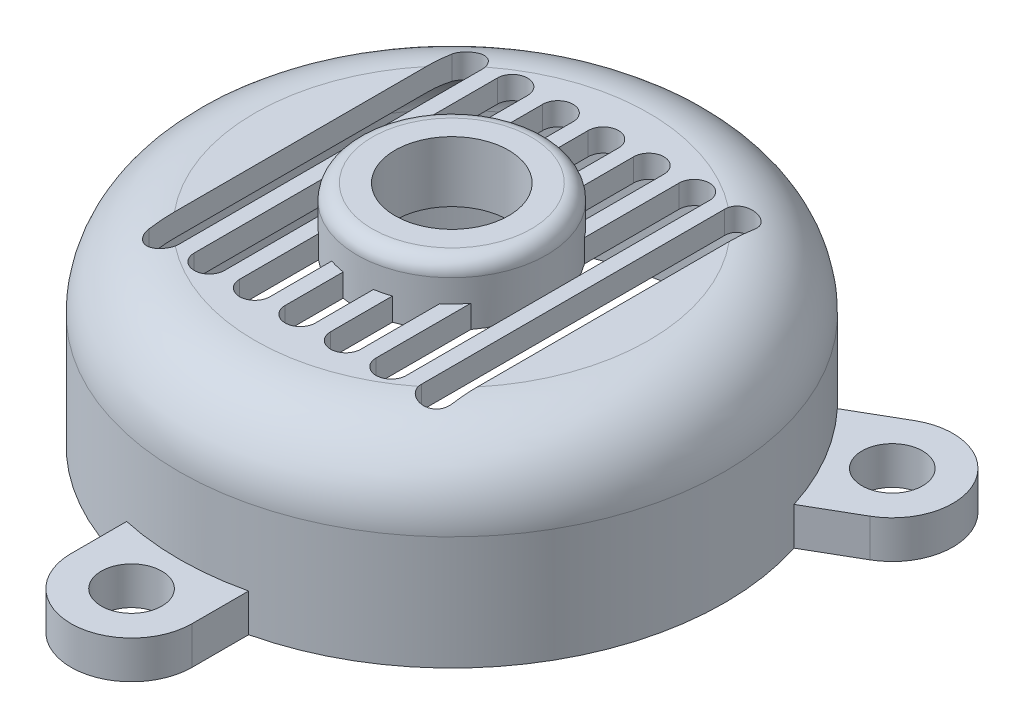
from build123d import *

# Parameters (mm, degrees)
SKETCH1_R                = 36
BOSS_EXTRUDE1_DEPTH      = 25
FILLET1_R                = 10
SHELL1_T                 = -3
SKETCH2_R                = 4
BOSS_EXTRUDE2_DEPTH      = 5
CIRPATTERN1_COUNT        = 3
CUT_EXTRUDE2_DEPTH       = 73.063471868
LPATTERN1_COUNT          = 7
LPATTERN1_PITCH          = 6
BOSS_EXTRUDE3_DEPTH      = 5
BOSS_EXTRUDE3_DEPTH_BACK = 3
SKETCH5_R                = 12.5
FILLET2_R                = 2
SKETCH6_R                = 7.5
CUT_EXTRUDE3_DEPTH       = 74.946899716


with BuildPart() as part:
    # Sketch1 → Boss-Extrude1 (new body)
    with BuildSketch(Plane(origin=(0, 0, 0), x_dir=(1, 0, 0), z_dir=(0, 1, 0))):
        Circle(SKETCH1_R)
    extrude(amount=BOSS_EXTRUDE1_DEPTH)

    # Fillet1
    fillet1_edges = [part.edges().sort_by_distance(p)[0] for p in [
        (-36, 25, 0),
    ]]
    fillet(fillet1_edges, radius=FILLET1_R)

    # Shell1
    shell1_openings = [part.faces().sort_by_distance(p)[0] for p in [
        (0, 0, 0),
    ]]
    offset(amount=SHELL1_T, openings=shell1_openings, kind=Kind.INTERSECTION)

    # Sketch2 → Boss-Extrude2 (add)
    with BuildSketch(Plane.XZ):
        with BuildLine():
            Line((-7.770209707, 33), (8.229790293, 33))
            Line((8.229790293, 33), (8.229790293, 42.5))
            ThreePointArc((8.229790293, 42.5), (0.229790293, 50.5), (-7.770209707, 42.5))
            Line((-7.770209707, 42.5), (-7.770209707, 33))
        make_face()
        with Locations((0.229790293, 42.5)):
            Circle(SKETCH2_R, mode=Mode.SUBTRACT)
    boss_extrude2 = extrude(amount=-BOSS_EXTRUDE2_DEPTH)

    # CirPattern1: Boss-Extrude2 ×3 about axis
    cirpattern1_axis = Axis((0, 25, 0), (0, -1, 0))
    for i in range(1, CIRPATTERN1_COUNT):
        add(boss_extrude2.rotate(cirpattern1_axis, i * 360 / CIRPATTERN1_COUNT))

    # Sketch3 → Cut-Extrude2 (cut, through all)
    with BuildSketch(Plane(origin=(0, 25, 0), x_dir=(1, 0, 0), z_dir=(0, 1, 0))):
        with BuildLine():
            Line((-16, 20), (-16, -20))
            ThreePointArc((-16, -20), (-18, -22), (-20, -20))
            Line((-20, -20), (-20, 20))
            ThreePointArc((-20, 20), (-18, 22), (-16, 20))
        make_face()
    cut_extrude2 = extrude(amount=-CUT_EXTRUDE2_DEPTH, mode=Mode.SUBTRACT)

    # LPattern1: Cut-Extrude2 ×7
    with Locations(*[(i * LPATTERN1_PITCH, 0, 0) for i in range(1, LPATTERN1_COUNT)]):
        add(cut_extrude2, mode=Mode.SUBTRACT)

    # Sketch5 → Boss-Extrude3 (add, two sides: drawn at the far end of the back side and taken through both)
    with BuildSketch(Plane(origin=(0, 25, 0), x_dir=(1, 0, 0), z_dir=(0, 1, 0)).offset(-BOSS_EXTRUDE3_DEPTH_BACK)):
        Circle(SKETCH5_R)
    extrude(amount=BOSS_EXTRUDE3_DEPTH + BOSS_EXTRUDE3_DEPTH_BACK)

    # Fillet2
    fillet2_edges = [part.edges().sort_by_distance(p)[0] for p in [
        (-12.5, 30, 0),
    ]]
    fillet(fillet2_edges, radius=FILLET2_R)

    # Sketch6 → Cut-Extrude3 (cut, through all)
    with BuildSketch(Plane(origin=(0, 30, 0), x_dir=(1, 0, 0), z_dir=(0, 1, 0))):
        Circle(SKETCH6_R)
    extrude(amount=-CUT_EXTRUDE3_DEPTH, mode=Mode.SUBTRACT)


solid = part.part
